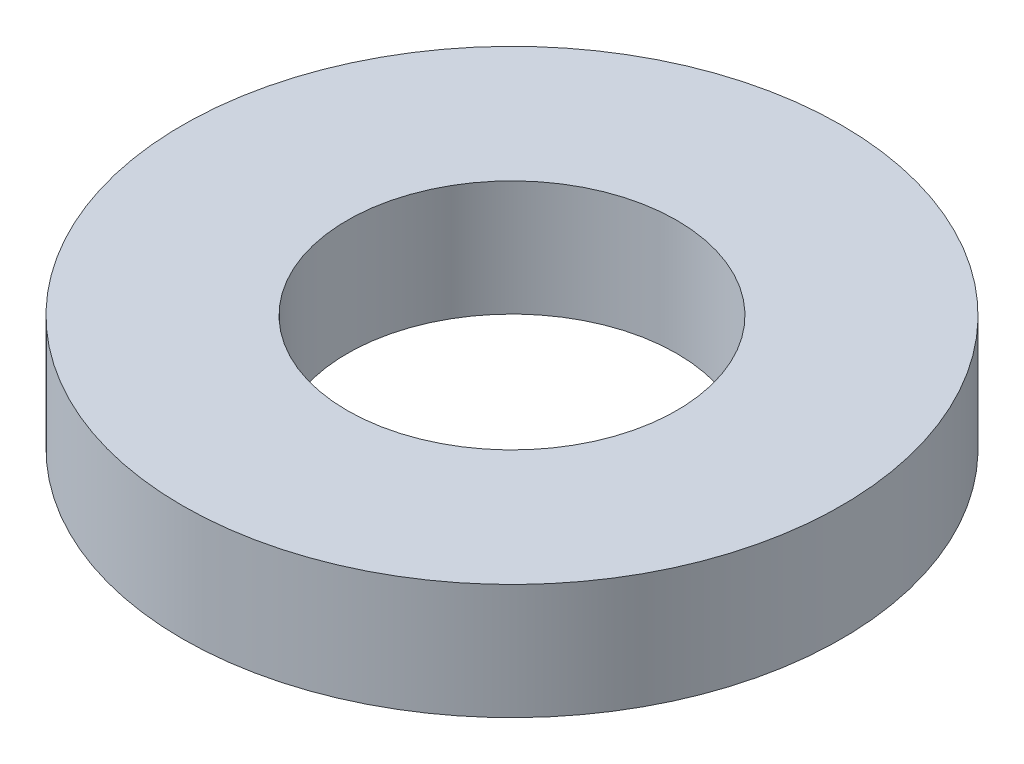
from build123d import *

# Parameters (mm, degrees)
SKETCH1_R           = 60
BOSS_EXTRUDE1_DEPTH = 21
SKETCH2_R           = 30
CUT_EXTRUDE1_DEPTH  = 88.412813706


with BuildPart() as part:
    # Sketch1 → Boss-Extrude1 (new body)
    with BuildSketch(Plane(origin=(0, 0, 0), x_dir=(1, 0, 0), z_dir=(0, 1, 0))):
        Circle(SKETCH1_R)
    extrude(amount=BOSS_EXTRUDE1_DEPTH)

    # Sketch2 → Cut-Extrude1 (cut, through all)
    with BuildSketch(Plane(origin=(0, 0, 0), x_dir=(1, 0, 0), z_dir=(0, 1, 0))):
        Circle(SKETCH2_R)
    extrude(amount=CUT_EXTRUDE1_DEPTH, mode=Mode.SUBTRACT)


solid = part.part
